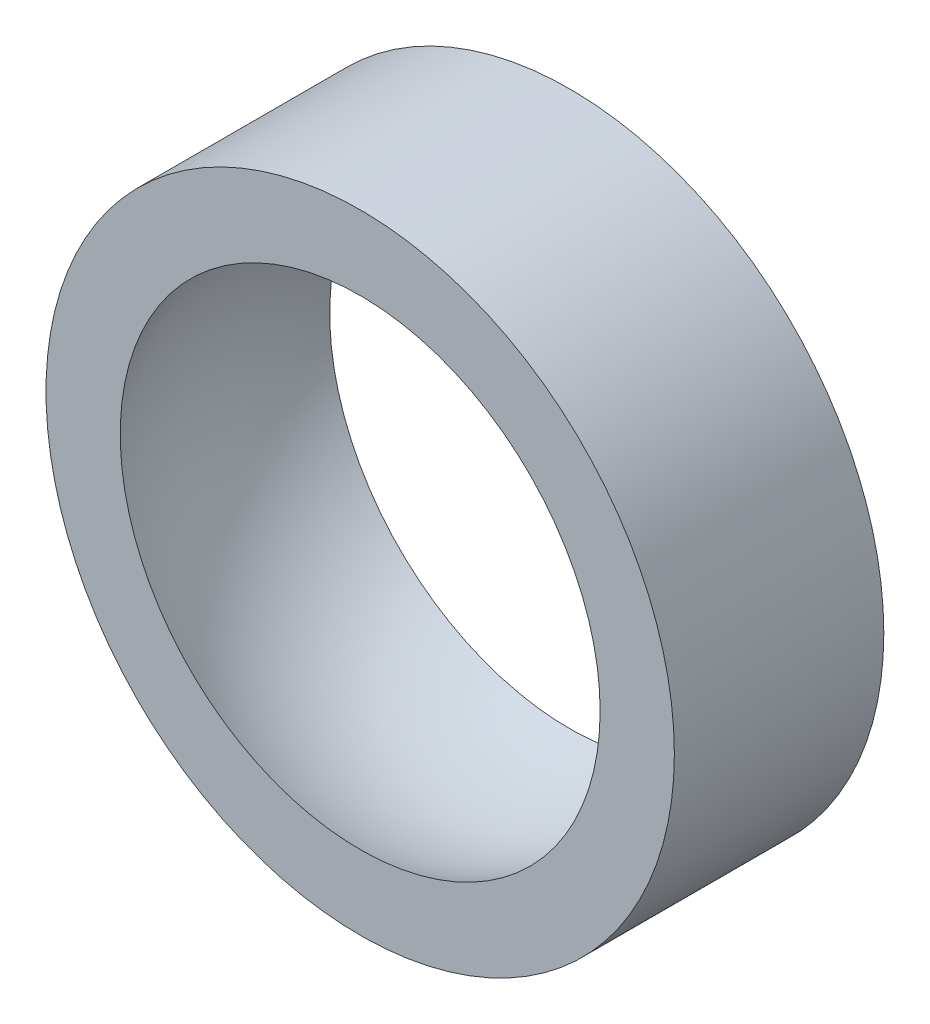
from build123d import *

# Parameters (mm, degrees)
DIA_CYLINDRE_R = 15
CYLINDRE_DEPTH = 5


with BuildPart() as part:
    # Dia cylindre → Cylindre (new, symmetric)
    with BuildSketch(Plane.XY):
        Circle(DIA_CYLINDRE_R)
    extrude(amount=CYLINDRE_DEPTH, both=True)

    # Esquisse sphère → Sphère intérieure (revolve, cut)
    with BuildSketch(Plane.XY):
        with BuildLine():
            Line((0, 12.5), (0, -12.5))
            ThreePointArc((0, -12.5), (12.5, 0), (0, 12.5))
        make_face()
    revolve(axis=Axis((0, 20, 0), (0, -1, 0)), mode=Mode.SUBTRACT)


solid = part.part
